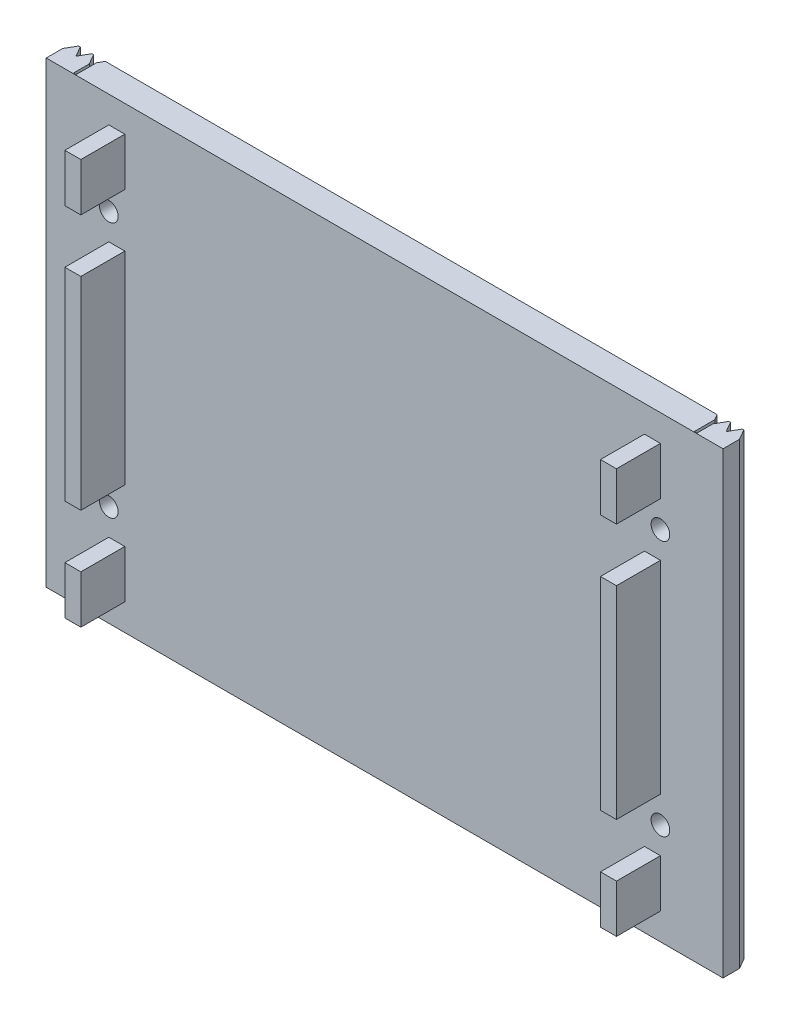
from build123d import *

# Parameters (mm, degrees)
MAIN_BODY_DEPTH     = 172
SKETCH2_R           = 3.5
SKETCH3_R           = 2.5
SKETCH2_3_R         = 3.5
SKETCH3_3_R         = 2.5
SKETCH4_W           = 6
SKETCH4_H           = 76
SKETCH4_H_2         = 18
BOSS_EXTRUDE1_DEPTH = 16.5
CUT_EXTRUDE1_DEPTH  = 215.441717024
LPATTERN1_DEPTH     = 172


# Read off the part's stored shape, not the designer's step: Mirror2, LPattern1
with BuildPart() as part:
    # Sketch1 → Main Body (new body)
    with BuildSketch(Plane(origin=(0, 0, 0), x_dir=(1, 0, 0), z_dir=(0, 1, 0))):
        Polygon((-127, 0), (-127, 10), (-117, 10), (-117, 0.2), (-116, 0.2), (-116, 10), (116, 10), (116, 0.2), (117, 0.2), (117, 10), (127, 10), (127, 0), align=None)
    extrude(amount=MAIN_BODY_DEPTH)

    # Sketch2 → Cut-Loft2 section 0
    with BuildSketch(Plane(origin=(0, 0, -10), x_dir=(-1, 0, 0), z_dir=(0, 0, -1))):
        with Locations((103.5, 134)):
            Circle(SKETCH2_R)
    # Sketch3 → Cut-Loft2 section 1
    with BuildSketch(Plane.XY.offset(-5)):
        with Locations((-103.5, 134)):
            Circle(SKETCH3_R)
    cut_loft2 = loft(mode=Mode.SUBTRACT)

    # Sketch2<3> → Cut-Loft3 section 0
    with BuildSketch(Plane(origin=(0, 0, -10), x_dir=(-1, 0, 0), z_dir=(0, 0, -1))):
        with Locations((103.5, 38)):
            Circle(SKETCH2_3_R)
    # Sketch3<3> → Cut-Loft3 section 1
    with BuildSketch(Plane.XY.offset(-5)):
        with Locations((-103.5, 38)):
            Circle(SKETCH3_3_R)
    cut_loft3 = loft(mode=Mode.SUBTRACT)

    # Mirror1: Cut-Loft2, Cut-Loft3 across plane
    add(cut_loft2.mirror(Plane.XY.offset(-5)), mode=Mode.SUBTRACT)
    add(cut_loft3.mirror(Plane.XY.offset(-5)), mode=Mode.SUBTRACT)

    # Mirror2 outline → Mirror2 (revolve, cut)
    with BuildSketch(Plane(origin=(103.5, 134, 0), x_dir=(1, 0, 0), z_dir=(0, -1, 0))):
        Polygon((3.5, -10), (2.5, -5), (3.5, 0), (0, 0), (0, -10), align=None)
    revolve(axis=Axis((103.5, 134, 0), (0, 0, 1)), mode=Mode.SUBTRACT)

    # Mirror2 2 outline → Mirror2 2 (revolve, cut)
    with BuildSketch(Plane(origin=(103.5, 38, 0), x_dir=(1, 0, 0), z_dir=(0, -1, 0))):
        Polygon((3.5, -10), (2.5, -5), (3.5, 0), (0, 0), (0, -10), align=None)
    revolve(axis=Axis((103.5, 38, 0), (0, 0, 1)), mode=Mode.SUBTRACT)

    # Sketch4 → Boss-Extrude1 (add)
    with BuildSketch(Plane.XY):
        with Locations((100.5, 86)):
            Rectangle(SKETCH4_W, SKETCH4_H)
        with Locations((100.5, 153)):
            Rectangle(SKETCH4_W, SKETCH4_H_2)
        with Locations((100.5, 19)):
            Rectangle(SKETCH4_W, SKETCH4_H_2)
    boss_extrude1 = extrude(amount=BOSS_EXTRUDE1_DEPTH)

    # Mirror3: Boss-Extrude1 across plane
    add(boss_extrude1.mirror(Plane(origin=(0, 0, 0), x_dir=(0, 0, 1), z_dir=(1, 0, 0))))

    # Sketch5 → Cut-Extrude1 (cut, through all)
    with BuildSketch(Plane(origin=(0, 172, 0), x_dir=(1, 0, 0), z_dir=(0, 1, 0))):
        Polygon((129.5, 10.5), (127, 6.169872981), (124.5, 10.5), align=None)
    cut_extrude1 = extrude(amount=-CUT_EXTRUDE1_DEPTH, mode=Mode.SUBTRACT)

    # LPattern1 outline → LPattern1 (cut)
    with BuildSketch(Plane(origin=(0, 0, 0), x_dir=(1, 0, 0), z_dir=(0, 1, 0))):
        Polygon((119.788675135, 10), (122, 6.169872981), (124.211324865, 10), align=None)
        Polygon((117, 6.169872981), (119.211324865, 10), (117, 10), align=None)
        Polygon((116, 10), (114.788675135, 10), (116, 7.901923789), align=None)
    lpattern1 = extrude(amount=LPATTERN1_DEPTH, mode=Mode.SUBTRACT)

    # Mirror4: Cut-Extrude1, LPattern1 across plane
    add(cut_extrude1.mirror(Plane(origin=(0, 0, 0), x_dir=(0, 0, 1), z_dir=(1, 0, 0))), mode=Mode.SUBTRACT)
    add(lpattern1.mirror(Plane(origin=(0, 0, 0), x_dir=(0, 0, 1), z_dir=(1, 0, 0))), mode=Mode.SUBTRACT)


solid = part.part
